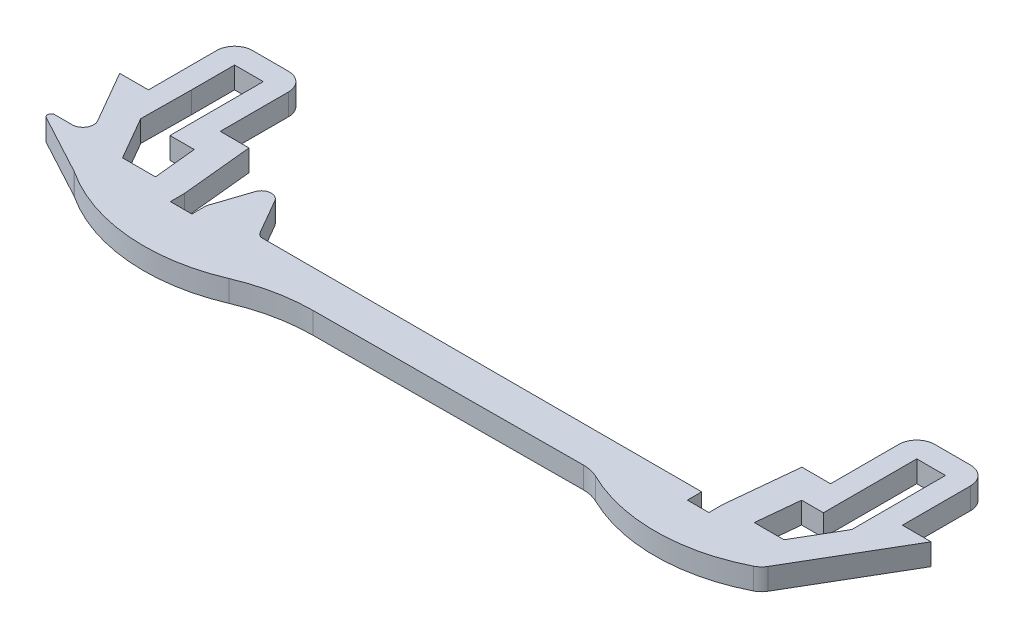
from build123d import *

# Parameters (mm, degrees)
BOSS_EXTRUDE1_DEPTH = 3
FILLET2_R           = 2.5
FILLET3_R           = 1
FILLET5_R           = 2.5
FILLET6_R           = 5
FILLET7_R           = 25


with BuildPart() as part:
    # Sketch1 → Boss-Extrude1 (new body)
    with BuildSketch(Plane(origin=(0, 0, 0), x_dir=(1, 0, 0), z_dir=(0, 1, 0))):
        with BuildLine():
            Line((-62.418566214, -47.190177149), (-58.418566214, -47.190177149))
            Line((-58.418566214, -47.190177149), (-58.418566214, -35.190177149))
            Line((-58.418566214, -35.190177149), (-48.418566214, -35.190177149))
            Line((-48.418566214, -35.190177149), (-48.418566214, -47.190177149))
            Line((-48.418566214, -47.190177149), (-44.418566214, -47.190177149))
            Line((-44.418566214, -47.190177149), (-43.418817081, -57.187668474))
            Line((-43.418817081, -57.187668474), (-43.418817081, -59.137504987))
            Line((-43.418817081, -59.137504987), (-40.418817081, -59.137504987))
            Line((-40.418817081, -59.137504987), (-40.418817081, -57.137504987))
            Line((-40.418817081, -57.137504987), (-38.722684913, -52.023499684))
            ThreePointArc((-38.722684913, -52.023499684), (-37.561438496, -51.091888176), (-36.235977812, -51.769787298))
            Line((-36.235977812, -51.769787298), (-33.13692456, -57.137504987))
            Line((-33.13692456, -57.137504987), (28.581433786, -57.137504987))
            Line((28.581433786, -57.137504987), (28.581433786, -59.137504987))
            Line((28.581433786, -59.137504987), (31.581433786, -59.137504987))
            Line((31.581433786, -59.137504987), (31.581433786, -57.187643384))
            Line((31.581433786, -57.187643384), (32.581433786, -47.190177149))
            Line((32.581433786, -47.190177149), (36.581433786, -47.190177149))
            Line((36.581433786, -47.190177149), (36.581433786, -35.190177149))
            Line((36.581433786, -35.190177149), (46.581433786, -35.190177149))
            Line((46.581433786, -35.190177149), (46.581433786, -47.190177149))
            Line((46.581433786, -47.190177149), (50.581433786, -47.190177149))
            Line((50.581433786, -47.190177149), (41.830568429, -62.137504987))
            ThreePointArc((41.830568429, -62.137504987), (30.081433786, -65.137504987), (18.332299143, -62.137504987))
            Line((18.332299143, -62.137504987), (-26.340663857, -62.360316421))
            ThreePointArc((-26.340663857, -62.360316421), (-40.074739293, -66.344446247), (-53.758312176, -62.190177149))
            Line((-53.758312176, -62.190177149), (-62.202371167, -57.642224353))
            ThreePointArc((-62.202371167, -57.642224353), (-62.450096964, -57.079754395), (-61.965274707, -56.702013871))
            Line((-61.965274707, -56.702013871), (-59.524980934, -56.702013871))
            ThreePointArc((-59.524980934, -56.702013871), (-58.225942828, -55.952013871), (-58.225942828, -54.452013871))
            Line((-58.225942828, -54.452013871), (-62.418566214, -47.190177149))
        make_face()
        Polygon((36.547763078, -51.190177149), (39.581433786, -51.190177149), (39.581433786, -44.190177149), (39.581433786, -38.190177149), (43.581433786, -38.190177149), (43.581433786, -44.229690019), (43.581433786, -51.229690019), (40.093369012, -57.187643384), (35.947864455, -57.187643384), align=None, mode=Mode.SUBTRACT)
        Polygon((-55.418566214, -38.190177149), (-51.418566214, -38.190177149), (-51.418566214, -44.190177149), (-51.418566214, -51.190177149), (-48.038516462, -51.190177149), (-47.438516462, -57.190177149), (-52.026261368, -57.190177149), (-55.490362984, -51.190177149), (-55.418566214, -44.190545357), align=None, mode=Mode.SUBTRACT)
    extrude(amount=BOSS_EXTRUDE1_DEPTH)

    # Fillet2
    fillet2_edges = [part.edges().sort_by_distance(p)[0] for p in [
        (-58.418566214, 1.5, 35.190177149),
        (-48.418566214, 1.5, 35.190177149),
        (36.581433786, 1.5, 35.190177149),
        (46.581433786, 1.5, 35.190177149),
    ]]
    fillet(fillet2_edges, radius=FILLET2_R)

    # Fillet3
    fillet3_edges = [part.edges().sort_by_distance(p)[0] for p in [
        (-33.13692456, 1.5, 57.137504987),
    ]]
    fillet(fillet3_edges, radius=FILLET3_R)

    # Fillet5
    # the kernel refuses this fillet: 2.5 mm, written as the material it adds along each edge
    with BuildSketch(Plane(origin=(-53.758312176, 0, 62.190177149), x_dir=(0.835787745770118, 0, 0.5490526787299234), z_dir=(0, 1, 0))) as fillet5_piece_1:
        with BuildLine():
            CenterArc((0.109109334, -2.499994653), FILLET5_R, 90.11850268, 4.876730224)
            Line((-0.10857281, -0.009489788), (0, 0))
            ThreePointArc((0, 0), (0.051969341, -5.3743e-05), (0.103938683, 0))
        make_face()
    extrude(amount=3)
    # the kernel refuses this fillet: 2.5 mm, written as the material it takes off along each edge
    with BuildSketch(Plane(origin=(41.830568429, -1.88265381, 62.137504987), x_dir=(0.5052312330715905, 0, -0.8629840097759403), z_dir=(0, 1, 0))) as fillet5_2_piece_1:
        with BuildLine():
            CenterArc((0.713618061, 2.5), FILLET5_R, 237.2334899, 32.7665101)
            ThreePointArc((-0.639423937, 0.397792267), (-0.321239998, 0.19643993), (0, 0))
            Line((0, 0), (0.713618061, 0))
        make_face()
    extrude(amount=6.76530762, mode=Mode.SUBTRACT)

    # Fillet6
    fillet6_edges = [part.edges().sort_by_distance(p)[0] for p in [
        (18.332299143, 1.5, 62.137504987),
    ]]
    fillet(fillet6_edges, radius=FILLET6_R)

    # Fillet7
    fillet7_edges = [part.edges().sort_by_distance(p)[0] for p in [
        (-26.340663857, 1.5, 62.360316421),
    ]]
    fillet(fillet7_edges, radius=FILLET7_R)


solid = part.part
